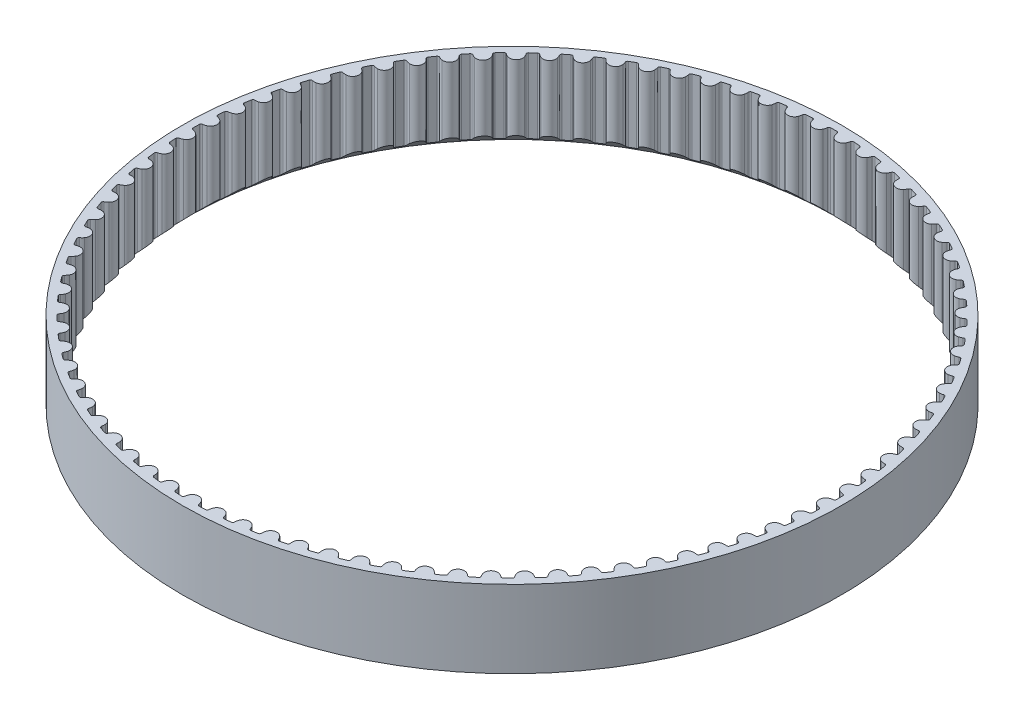
from build123d import *

# Parameters (mm, degrees)
BOSS_EXTRUDE3_OUTLINE_R = 27.685
BOSS_EXTRUDE3_DEPTH     = 6.5


# Read off the part's stored shape, not the designer's step: Boss-Extrude3
with BuildPart() as part:
    # Boss-Extrude3 outline → Boss-Extrude3 (new body)
    with BuildSketch(Plane(origin=(0, 0, 0), x_dir=(1, 0, 0), z_dir=(0, 1, 0))):
        Circle(BOSS_EXTRUDE3_OUTLINE_R)
        with BuildLine():
            ThreePointArc((-0.406733695, 26.901015291), (-0.35782791, 26.994719783), (-0.259268366, 27.032907789))
            ThreePointArc((-0.259268366, 27.032907789), (4.95e-05, 27.034151062), (0.259367362, 27.03290684))
            ThreePointArc((0.259367362, 27.03290684), (0.357926765, 26.994718472), (0.406832207, 26.901013801))
            ThreePointArc((0.406832207, 26.901013801), (0.435415402, 26.756177152), (0.485011037, 26.617127065))
            ThreePointArc((0.485011037, 26.617127065), (0.972057324, 26.287033487), (1.48215289, 26.58025417))
            ThreePointArc((1.48215289, 26.58025417), (1.541882783, 26.715261554), (1.581084995, 26.857591594))
            ThreePointArc((1.581084995, 26.857591594), (1.636777541, 26.947428379), (1.737888216, 26.97823323))
            ThreePointArc((1.737888216, 26.97823323), (1.996589749, 26.960321827), (2.255107569, 26.939929723))
            ThreePointArc((2.255107569, 26.939929723), (2.350577517, 26.89456678), (2.39242908, 26.79750621))
            ThreePointArc((2.39242908, 26.79750621), (2.410237667, 26.650954144), (2.449428664, 26.508621015))
            ThreePointArc((2.449428664, 26.508621015), (2.910766667, 26.143459266), (3.441124339, 26.398207367))
            ThreePointArc((3.441124339, 26.398207367), (3.510661756, 26.528434866), (3.560268348, 26.667481045))
            ThreePointArc((3.560268348, 26.667481045), (3.62244348, 26.752959466), (3.725553056, 26.776212915))
            ThreePointArc((3.725553056, 26.776212915), (3.982225317, 26.739244663), (4.238531162, 26.699816052))
            ThreePointArc((4.238531162, 26.699816052), (4.33039023, 26.647526291), (4.364959335, 26.547639933))
            ThreePointArc((4.364959335, 26.547639933), (4.371896049, 26.400172866), (4.400468361, 26.25533407))
            ThreePointArc((4.400468361, 26.25533407), (4.833578411, 25.857098537), (5.38130156, 26.07198271))
            ThreePointArc((5.38130156, 26.07198271), (5.460266712, 26.196719066), (5.520006749, 26.331721962))
            ThreePointArc((5.520006749, 26.331721962), (5.588324889, 26.412375166), (5.692870216, 26.427950211))
            ThreePointArc((5.692870216, 26.427950211), (5.946111351, 26.372127018), (6.198805367, 26.313877245))
            ThreePointArc((6.198805367, 26.313877245), (6.286551852, 26.254946253), (6.313649695, 26.152779652))
            ThreePointArc((6.313649695, 26.152779652), (6.30967665, 26.005202998), (6.327474226, 25.858649594))
            ThreePointArc((6.327474226, 25.858649594), (6.729990827, 25.429515302), (7.292087977, 25.603361925))
            ThreePointArc((7.292087977, 25.603361925), (7.380049585, 25.721925871), (7.449596787, 25.852148145))
            ThreePointArc((7.449596787, 25.852148145), (7.523684805, 25.927535631), (7.629094894, 25.935347207))
            ThreePointArc((7.629094894, 25.935347207), (7.877521787, 25.860973959), (8.125223846, 25.784221165))
            ThreePointArc((8.125223846, 25.784221165), (8.208378509, 25.718970804), (8.22785709, 25.615081957))
            ThreePointArc((8.22785709, 25.615081957), (8.212995986, 25.468201729), (8.21992162, 25.320734142))
            ThreePointArc((8.21992162, 25.320734142), (8.589646366, 24.863044872), (9.16304754, 24.994904455))
            ThreePointArc((9.16304754, 24.994904455), (9.259525186, 25.106648437), (9.338499711, 25.231378859))
            ThreePointArc((9.338499711, 25.231378859), (9.417952964, 25.301088888), (9.523652101, 25.30109433))
            ThreePointArc((9.523652101, 25.30109433), (9.765907931, 25.208577229), (10.007265171, 25.11374061))
            ThreePointArc((10.007265171, 25.11374061), (10.085373848, 25.042527254), (10.097126783, 24.937483568))
            ThreePointArc((10.097126783, 24.937483568), (10.071458786, 24.792101975), (10.067474653, 24.64452562))
            ThreePointArc((10.067474653, 24.64452562), (10.402388235, 24.160781113), (10.983961713, 24.249933484))
            ThreePointArc((10.983961713, 24.249933484), (11.088428472, 24.354247195), (11.176398988, 24.472804532))
            ThreePointArc((11.176398988, 24.472804532), (11.26078353, 24.536456371), (11.366194422, 24.52865565))
            ThreePointArc((11.366194422, 24.52865565), (11.600956072, 24.418499992), (11.834650283, 24.306097513))
            ThreePointArc((11.834650283, 24.306097513), (11.907286373, 24.229310105), (11.911249471, 24.123685291))
            ThreePointArc((11.911249471, 24.123685291), (11.874914771, 23.980596356), (11.860042631, 23.833717245))
            ThreePointArc((11.860042631, 23.833717245), (12.158315868, 23.326559546), (12.744885297, 23.372517786))
            ThreePointArc((12.744885297, 23.372517786), (12.856770607, 23.4688315), (12.953256649, 23.580568233))
            ThreePointArc((12.953256649, 23.580568233), (13.0421116, 23.637814238), (13.146658531, 23.622249959))
            ThreePointArc((13.146658531, 23.622249959), (13.372643814, 23.495057375), (13.597398639, 23.36570294))
            ThreePointArc((13.597398639, 23.36570294), (13.664165429, 23.283760867), (13.660317045, 23.178131811))
            ThreePointArc((13.660317045, 23.178131811), (13.613514089, 23.038117036), (13.587835169, 22.892737371))
            ThreePointArc((13.587835169, 22.892737371), (13.847838995, 22.3649364), (14.436200737, 22.367449501))
            ThreePointArc((14.436200737, 22.367449501), (14.554893518, 22.455237186), (14.659368114, 22.559543047))
            ThreePointArc((14.659368114, 22.559543047), (14.75220818, 22.610070561), (14.85532015, 22.586827729))
            ThreePointArc((14.85532015, 22.586827729), (15.071294813, 22.443292902), (15.28588272, 22.297693))
            ThreePointArc((15.28588272, 22.297693), (15.346415551, 22.2110438), (15.334776704, 22.105987411))
            ThreePointArc((15.334776704, 22.105987411), (15.277761114, 21.969811509), (15.241415662, 21.826725305))
            ThreePointArc((15.241415662, 21.826725305), (15.461730028, 21.281163726), (16.048670655, 21.240217963))
            ThreePointArc((16.048670655, 21.240217963), (16.173522649, 21.319000153), (16.285415194, 21.41530546))
            ThreePointArc((16.285415194, 21.41530546), (16.381733315, 21.458838518), (16.482847162, 21.428044079))
            ThreePointArc((16.482847162, 21.428044079), (16.687631626, 21.268950947), (16.890880609, 21.107900793))
            ThreePointArc((16.890880609, 21.107900793), (16.944848874, 21.017017715), (16.92548313, 20.913107775))
            ThreePointArc((16.92548313, 20.913107775), (16.858566305, 20.781514491), (16.811752829, 20.641503233))
            ThreePointArc((16.811752829, 20.641503233), (16.991174453, 20.081160716), (17.573488299, 19.99697972))
            ThreePointArc((17.573488299, 19.99697972), (17.703817608, 20.066326134), (17.822516984, 20.154104901))
            ThreePointArc((17.822516984, 20.154104901), (17.921787103, 20.190405741), (18.020350579, 20.152227883))
            ThreePointArc((18.020350579, 20.152227883), (18.212826381, 19.978445356), (18.403626366, 19.802824551))
            ThreePointArc((18.403626366, 19.802824551), (18.450735307, 19.708203966), (18.423748437, 19.606007996))
            ThreePointArc((18.423748437, 19.606007996), (18.347295853, 19.479716047), (18.290270032, 19.343544429))
            ThreePointArc((18.290270032, 19.343544429), (18.427818975, 18.77148137), (19.002325643, 18.644524908))
            ThreePointArc((19.002325643, 18.644524908), (19.137420453, 18.7040568), (19.262278366, 18.782829609))
            ThreePointArc((19.262278366, 18.782829609), (19.363958304, 18.811699969), (19.459433089, 18.766347207))
            ThreePointArc((19.459433089, 18.766347207), (19.638548995, 18.578824425), (19.815857898, 18.389592149))
            ThreePointArc((19.815857898, 18.389592149), (19.855850223, 18.291750842), (19.821389618, 18.191827))
            ThreePointArc((19.821389618, 18.191827), (19.735818834, 18.071526149), (19.668892122, 17.939937893))
            ThreePointArc((19.668892122, 17.939937893), (19.76381714, 17.359278702), (20.327378875, 17.190240167))
            ThreePointArc((20.327378875, 17.190240167), (20.466501345, 17.239632395), (20.596835864, 17.308969016))
            ThreePointArc((20.596835864, 17.308969016), (20.700370281, 17.330251216), (20.792234924, 17.27797125))
            ThreePointArc((20.792234924, 17.27797125), (20.957012664, 17.077732398), (21.119862085, 16.875922172))
            ThreePointArc((21.119862085, 16.875922172), (21.152519371, 16.775394518), (21.110773243, 16.678288553))
            ThreePointArc((21.110773243, 16.678288553), (21.016551616, 16.564635842), (20.940089544, 16.438349637))
            ThreePointArc((20.940089544, 16.438349637), (20.99187219, 15.852265673), (21.541411012, 15.642068295))
            ThreePointArc((21.541411012, 15.642068295), (21.683801303, 15.681051095), (21.818900586, 15.740572836))
            ThreePointArc((21.818900586, 15.740572836), (21.923724013, 15.754150639), (22.011476782, 15.695229005))
            ThreePointArc((22.011476782, 15.695229005), (22.161016397, 15.483367718), (22.308516909, 15.270081759))
            ThreePointArc((22.308516909, 15.270081759), (22.333660792, 15.167416806), (22.284857146, 15.073659078))
            ThreePointArc((22.284857146, 15.073659078), (22.182499281, 14.967275238), (22.096919458, 14.846980816))
            ThreePointArc((22.096919458, 14.846980816), (22.105276912, 14.258673066), (22.637791432, 14.00846487))
            ThreePointArc((22.637791432, 14.00846487), (22.782671859, 14.036825331), (22.921798039, 14.086207106))
            ThreePointArc((22.921798039, 14.086207106), (23.027337967, 14.092006356), (23.110499587, 14.026764862))
            ThreePointArc((23.110499587, 14.026764862), (23.243984343, 13.804438253), (23.37533035, 13.580841456))
            ThreePointArc((23.37533035, 13.580841456), (23.392823503, 13.476599924), (23.337228886, 13.386702504))
            ThreePointArc((23.337228886, 13.386702504), (23.227293828, 13.288168566), (23.133063661, 13.174522935))
            ThreePointArc((23.133063661, 13.174522935), (23.097950278, 12.587204532), (23.610532085, 12.298352067))
            ThreePointArc((23.610532085, 12.298352067), (23.75711136, 12.315935296), (23.89950458, 12.354907397))
            ThreePointArc((23.89950458, 12.354907397), (24.005184586, 12.35289642), (24.083300857, 12.281691394))
            ThreePointArc((24.083300857, 12.281691394), (24.200001708, 12.050113734), (24.314475843, 11.817427306))
            ThreePointArc((24.314475843, 11.817427306), (24.324222725, 11.712178525), (24.262140774, 11.626632403))
            ThreePointArc((24.262140774, 11.626632403), (24.14522895, 11.536486526), (24.042863092, 11.430110377))
            ThreePointArc((24.042863092, 11.430110377), (23.96447065, 10.846989052), (24.4543202, 10.521069931))
            ThreePointArc((24.4543202, 10.521069931), (24.601797758, 10.527779893), (24.746680315, 10.556129469))
            ThreePointArc((24.746680315, 10.556129469), (24.851923211, 10.546319247), (24.924567489, 10.469539586))
            ThreePointArc((24.924567489, 10.469539586), (25.023847055, 10.229975671), (25.1208241, 9.989470465))
            ThreePointArc((25.1208241, 9.989470465), (25.122771476, 9.883789269), (25.054541264, 9.803061667))
            ThreePointArc((25.054541264, 9.803061667), (24.931291204, 9.721796198), (24.821348743, 9.62327052))
            ThreePointArc((24.821348743, 9.62327052), (24.700105392, 9.047531078), (25.164547297, 8.686325358))
            ThreePointArc((25.164547297, 8.686325358), (25.312117668, 8.682125406), (25.458698264, 8.699697622))
            ThreePointArc((25.458698264, 8.699697622), (25.56292925, 8.682141736), (25.629704776, 8.600206783))
            ThreePointArc((25.629704776, 8.600206783), (25.711020826, 8.353965029), (25.789971127, 8.106954602))
            ThreePointArc((25.789971127, 8.106954602), (25.784108362, 8.001418184), (25.710102537, 7.925950009))
            ThreePointArc((25.710102537, 7.925950009), (25.581187391, 7.854008789), (25.464268793, 7.763871697))
            ThreePointArc((25.464268793, 7.763871697), (25.300836725, 7.198658627), (25.737334364, 6.804139089))
            ThreePointArc((25.737334364, 6.804139089), (25.884191568, 6.789052162), (26.03166963, 6.795751043))
            ThreePointArc((26.03166963, 6.795751043), (26.134319433, 6.770545378), (26.194861504, 6.683902633))
            ThreePointArc((26.194861504, 6.683902633), (26.257769918, 6.432327927), (26.318262275, 6.180161363))
            ThreePointArc((26.318262275, 6.180161363), (26.304621388, 6.075346127), (26.225244145, 6.005549559))
            ThreePointArc((26.225244145, 6.005549559), (26.091368004, 5.943325508), (25.968111838, 5.862069299))
            ThreePointArc((25.968111838, 5.862069299), (25.76338366, 5.310469599), (26.169553036, 4.884790972))
            ThreePointArc((26.169553036, 4.884790972), (26.314894991, 4.858899468), (26.462465045, 4.854688428))
            ThreePointArc((26.462465045, 4.854688428), (26.562973027, 4.821970648), (26.616950982, 4.731093325))
            ThreePointArc((26.616950982, 4.731093325), (26.661108176, 4.47555968), (26.702812201, 4.219614226))
            ThreePointArc((26.702812201, 4.219614226), (26.681467695, 4.116092636), (26.597152564, 4.052348881))
            ThreePointArc((26.597152564, 4.052348881), (26.459046612, 4.000181844), (26.330126061, 3.928250311))
            ThreePointArc((26.330126061, 3.928250311), (26.085219929, 3.393276628), (26.458842683, 2.93876382))
            ThreePointArc((26.458842683, 2.93876382), (26.601875582, 2.902209151), (26.748731652, 2.887111189))
            ThreePointArc((26.748731652, 2.887111189), (26.846548873, 2.847059987), (26.893667904, 2.752444426))
            ThreePointArc((26.893667904, 2.752444426), (26.918832707, 2.494347479), (26.941520626, 2.236021019))
            ThreePointArc((26.941520626, 2.236021019), (26.912589077, 2.134358475), (26.823796559, 2.077015678))
            ThreePointArc((26.823796559, 2.077015678), (26.682215082, 2.035190575), (26.548334266, 1.972976582))
            ThreePointArc((26.548334266, 1.972976582), (26.264587771, 1.457550756), (26.603623307, 0.976686159))
            ThreePointArc((26.603623307, 0.976686159), (26.743565953, 0.929667974), (26.888905962, 0.90376555))
            ThreePointArc((26.888905962, 0.90376555), (26.983498179, 0.856599672), (27.023500937, 0.75876263))
            ThreePointArc((27.023500937, 0.75876263), (27.029535908, 0.499512017), (27.033083808, 0.240215442))
            ThreePointArc((27.033083808, 0.240215442), (26.996723231, 0.140967187), (26.903938279, 0.090338536))
            ThreePointArc((26.903938279, 0.090338536), (26.759654548, 0.059083799), (26.621544676, 0.00692714))
            ThreePointArc((26.621544676, 0.00692714), (26.300507543, -0.486135751), (26.603104166, -0.990725822))
            ThreePointArc((26.603104166, -0.990725822), (26.73919224, -1.047950728), (26.882222392, -1.084516143))
            ThreePointArc((26.882222392, -1.084516143), (26.973072974, -1.138539094), (27.00574098, -1.239063265))
            ThreePointArc((27.00574098, -1.239063265), (26.992613157, -1.498051608), (26.977001661, -1.75690211))
            ThreePointArc((26.977001661, -1.75690211), (26.933410644, -1.853194014), (26.837140018, -1.896832003))
            ThreePointArc((26.837140018, -1.896832003), (26.690942059, -1.917345671), (26.54935744, -1.959160137))
            ThreePointArc((26.54935744, -1.959160137), (26.192783063, -2.427167155), (26.457288095, -2.952726803))
            ThreePointArc((26.457288095, -2.952726803), (26.588778333, -3.019845885), (26.728717445, -3.066874586))
            ThreePointArc((26.728717445, -3.066874586), (26.815330199, -3.127459554), (26.84048503, -3.230121826))
            ThreePointArc((26.84048503, -3.230121826), (26.808266113, -3.487433393), (26.773580486, -3.744424071))
            ThreePointArc((26.773580486, -3.744424071), (26.722997107, -3.837233712), (26.623766604, -3.873642705))
            ThreePointArc((26.623766604, -3.873642705), (26.4764529, -3.883303264), (26.33216682, -3.91454716))
            ThreePointArc((26.33216682, -3.91454716), (25.942002685, -4.354942213), (26.166971491, -4.898601014))
            ThreePointArc((26.166971491, -4.898601014), (26.293145738, -4.975247692), (26.429229513, -5.032482822))
            ThreePointArc((26.429229513, -5.032482822), (26.511131389, -5.099298914), (26.528635658, -5.203538581))
            ThreePointArc((26.528635658, -5.203538581), (26.477501616, -5.457768027), (26.423931298, -5.711495287))
            ThreePointArc((26.423931298, -5.711495287), (26.366631827, -5.80031577), (26.264983409, -5.829296913))
            ThreePointArc((26.264983409, -5.829296913), (26.117358537, -5.828051601), (25.971159037, -5.848554284))
            ThreePointArc((25.971159037, -5.848554284), (25.549536084, -6.258932087), (25.733739963, -6.817720765))
            ThreePointArc((25.733739963, -6.817720765), (25.853909099, -6.903476421), (25.985394293, -6.970605383))
            ThreePointArc((25.985394293, -6.970605383), (26.062137973, -7.043287672), (26.071896078, -7.148535413))
            ThreePointArc((26.071896078, -7.148535413), (26.002126186, -7.398294224), (25.92996376, -7.647372296))
            ThreePointArc((25.92996376, -7.647372296), (25.866261148, -7.731718515), (25.762749983, -7.753113522))
            ThreePointArc((25.762749983, -7.753113522), (25.615620218, -7.740969142), (25.468305788, -7.750618633))
            ThreePointArc((25.468305788, -7.750618633), (25.017526777, -8.128737845), (25.159959671, -8.699604489))
            ThreePointArc((25.159959671, -8.699604489), (25.273467374, -8.794000756), (25.399635861, -8.870656914))
            ThreePointArc((25.399635861, -8.870656914), (25.470802196, -8.948808436), (25.472760842, -9.054489424))
            ThreePointArc((25.472760842, -9.054489424), (25.384736161, -9.298413504), (25.294375753, -9.541482009))
            ThreePointArc((25.294375753, -9.541482009), (25.224617919, -9.620893294), (25.11980935, -9.634585315))
            ThreePointArc((25.11980935, -9.634585315), (24.973978264, -9.611608193), (24.826353486, -9.61035179))
            ThreePointArc((24.826353486, -9.61035179), (24.348880414, -9.954147255), (24.448764404, -10.533973991))
            ThreePointArc((24.448764404, -10.533973991), (24.554990734, -10.636495309), (24.675153426, -10.722259994))
            ThreePointArc((24.675153426, -10.722259994), (24.740353731, -10.805453911), (24.73450222, -10.910990953))
            ThreePointArc((24.73450222, -10.910990953), (24.628703509, -11.147748074), (24.520638636, -11.383479456))
            ThreePointArc((24.520638636, -11.383479456), (24.445206575, -11.45752209), (24.33967303, -11.463436343))
            ThreePointArc((24.33967303, -11.463436343), (24.195937102, -11.429751974), (24.048808249, -11.417596538))
            ThreePointArc((24.048808249, -11.417596538), (23.54724891, -11.725190564), (23.604038464, -12.310810579))
            ThreePointArc((23.604038464, -12.310810579), (23.70240325, -12.420897012), (23.81590386, -12.515301807))
            ThreePointArc((23.81590386, -12.515301807), (23.874782033, -12.603083743), (23.861152324, -12.707900433))
            ThreePointArc((23.861152324, -12.707900433), (23.738157419, -12.936197509), (23.612978294, -13.163304286))
            ThreePointArc((23.612978294, -13.163304286), (23.532283989, -13.231573874), (23.426601856, -13.229678057))
            ThreePointArc((23.426601856, -13.229678057), (23.285746121, -13.185470412), (23.139916761, -13.162482334))
            ThreePointArc((23.139916761, -13.162482334), (22.617010498, -13.432194949), (22.630395451, -14.020409789))
            ThreePointArc((22.630395451, -14.020409789), (22.720361458, -14.137460083), (22.826580085, -14.239989382))
            ThreePointArc((22.826580085, -14.239989382), (22.878814554, -14.331879902), (22.857481088, -14.435403768))
            ThreePointArc((22.857481088, -14.435403768), (22.717961745, -14.65399392), (22.576352053, -14.871235712))
            ThreePointArc((22.576352053, -14.871235712), (22.490836229, -14.93335939), (22.385582706, -14.923663857))
            ThreePointArc((22.385582706, -14.923663857), (22.24837647, -14.869174384), (22.104643073, -14.835479215))
            ThreePointArc((22.104643073, -14.835479215), (21.563245817, -15.065837343), (21.533153065, -15.653434383))
            ThreePointArc((21.533153065, -15.653434383), (21.614228931, -15.77680925), (21.712585446, -15.886903073))
            ThreePointArc((21.712585446, -15.886903073), (21.757890924, -15.982400304), (21.728970217, -16.084065934))
            ThreePointArc((21.728970217, -16.084065934), (21.573688442, -16.291755297), (21.416421606, -16.497945606))
            ThreePointArc((21.416421606, -16.497945606), (21.32655132, -16.553584075), (21.222301265, -16.536141781))
            ThreePointArc((21.222301265, -16.536141781), (21.089493902, -16.471668081), (20.948641489, -16.427449854))
            ThreePointArc((20.948641489, -16.427449854), (20.391710165, -16.617195357), (20.318304065, -17.200965346))
            ThreePointArc((20.318304065, -17.200965346), (20.390046981, -17.329990955), (20.480004194, -17.447048008))
            ThreePointArc((20.480004194, -17.447048008), (20.518133239, -17.545630377), (20.481783245, -17.644882508))
            ThreePointArc((20.481783245, -17.644882508), (20.311587134, -17.840536757), (20.139522091, -18.034549443))
            ThreePointArc((20.139522091, -18.034549443), (20.045788183, -18.083398825), (19.943110975, -18.058305032))
            ThreePointArc((19.943110975, -18.058305032), (19.81542783, -17.98419924), (19.678225689, -17.929699457))
            ThreePointArc((19.678225689, -17.929699457), (19.108802064, -18.077796013), (18.992483534, -18.654550601))
            ThreePointArc((18.992483534, -18.654550601), (19.054501665, -18.78852226), (19.135568261, -18.911903218))
            ThreePointArc((19.135568261, -18.911903218), (19.166312625, -19.013032302), (19.122731876, -19.109328853))
            ThreePointArc((19.122731876, -19.109328853), (18.93855098, -19.291879391), (18.75262749, -19.472654824))
            ThreePointArc((18.75262749, -19.472654824), (18.655541903, -19.514448321), (18.554998328, -19.481840083))
            ThreePointArc((18.554998328, -19.481840083), (18.433136764, -19.398506938), (18.300334245, -19.33402326))
            ThreePointArc((18.300334245, -19.33402326), (17.721528312, -19.439662016), (17.562932644, -20.00625117))
            ThreePointArc((17.562932644, -20.00625117), (17.614887268, -20.144437171), (17.68662049, -20.27346817))
            ThreePointArc((17.68662049, -20.27346817), (17.709812258, -20.376591637), (17.659238777, -20.469406671))
            ThreePointArc((17.659238777, -20.469406671), (17.462079028, -20.63785647), (17.26331254, -20.804407316))
            ThreePointArc((17.26331254, -20.804407316), (17.163405522, -20.838916667), (17.065544715, -20.798972079))
            ThreePointArc((17.065544715, -20.798972079), (16.950170297, -20.706866718), (16.822492721, -20.632751333))
            ThreePointArc((16.822492721, -20.632751333), (16.237465717, -20.695355326), (16.037459105, -21.248684532))
            ThreePointArc((16.037459105, -21.248684532), (16.079066466, -21.390330151), (16.141074531, -21.524306469))
            ThreePointArc((16.141074531, -21.524306469), (16.156587038, -21.628861094), (16.099297039, -21.717687687))
            ThreePointArc((16.099297039, -21.717687687), (15.890235256, -21.871116733), (15.679711364, -22.022533351))
            ThreePointArc((15.679711364, -22.022533351), (15.577528572, -22.049570076), (15.482885015, -22.002507303))
            ThreePointArc((15.482885015, -22.002507303), (15.374627878, -21.902132773), (15.252772576, -21.818790472))
            ThreePointArc((15.252772576, -21.818790472), (14.664719716, -21.838017782), (14.424394527, -22.375064948))
            ThreePointArc((14.424394527, -22.375064948), (14.455427378, -22.519396566), (14.50737162, -22.65758647))
            ThreePointArc((14.50737162, -22.65758647), (14.515120142, -22.763001213), (14.451426524, -22.847354225))
            ThreePointArc((14.451426524, -22.847354225), (14.231604529, -22.984924541), (14.010473041, -23.120379945))
            ThreePointArc((14.010473041, -23.120379945), (13.906572562, -23.13979638), (13.815663165, -23.085872461))
            ThreePointArc((13.815663165, -23.085872461), (13.715114573, -22.977776974), (13.599747076, -22.885662944))
            ThreePointArc((13.599747076, -22.885662944), (13.011880101, -22.861408558), (12.732548908, -23.379240519))
            ThreePointArc((12.732548908, -23.379240519), (12.752837759, -23.525469847), (12.794434476, -23.667118591))
            ThreePointArc((12.794434476, -23.667118591), (12.794376693, -23.772817712), (12.724627328, -23.852236436))
            ThreePointArc((12.724627328, -23.852236436), (12.495245714, -23.973196662), (12.264714374, -24.091951041))
            ThreePointArc((12.264714374, -24.091951041), (12.159663676, -24.103641141), (12.072984954, -24.04315059))
            ThreePointArc((12.072984954, -24.04315059), (11.980694068, -23.927924525), (11.872444473, -23.827541861))
            ThreePointArc((11.872444473, -23.827541861), (11.287974109, -23.759938247), (10.971162522, -24.255726784))
            ThreePointArc((10.971162522, -24.255726784), (10.980596562, -24.403055168), (11.011618568, -24.547389118))
            ThreePointArc((11.011618568, -24.547389118), (11.003754795, -24.652795325), (10.92833063, -24.726846003))
            ThreePointArc((10.92833063, -24.726846003), (10.690642199, -24.830535496), (10.451970089, -24.931940255))
            ThreePointArc((10.451970089, -24.931940255), (10.346342923, -24.935840172), (10.264368286, -24.869113367))
            ThreePointArc((10.264368286, -24.869113367), (10.180839166, -24.747386049), (10.080298696, -24.639283007))
            ThreePointArc((10.080298696, -24.639283007), (9.502417116, -24.528699394), (9.14985545, -24.999736682))
            ThreePointArc((9.14985545, -24.999736682), (9.148383154, -25.147359465), (9.168661018, -25.293590317))
            ThreePointArc((9.168661018, -25.293590317), (9.153034205, -25.398127919), (9.07234718, -25.466406112))
            ThreePointArc((9.07234718, -25.466406112), (8.827650103, -25.552258555), (8.582140768, -25.635759858))
            ThreePointArc((8.582140768, -25.635759858), (8.476514033, -25.631848291), (8.399691198, -25.559249672))
            ThreePointArc((8.399691198, -25.559249672), (8.325380051, -25.431685934), (8.233097823, -25.316452934))
            ThreePointArc((8.233097823, -25.316452934), (7.664961217, -25.16349329), (7.278575041, -25.607206687))
            ThreePointArc((7.278575041, -25.607206687), (7.26620445, -25.754317605), (7.27562742, -25.901646697))
            ThreePointArc((7.27562742, -25.901646697), (7.252322915, -26.004744746), (7.166813716, -26.066877542))
            ThreePointArc((7.166813716, -26.066877542), (6.916444445, -26.13442404), (6.66543877, -26.199565829))
            ThreePointArc((6.66543877, -26.199565829), (6.560389362, -26.187864143), (6.489137909, -26.109790217))
            ThreePointArc((6.489137909, -26.109790217), (6.424450598, -25.977086767), (6.340930624, -25.855353174))
            ThreePointArc((6.340930624, -25.855353174), (5.785641957, -25.660852911), (5.367541579, -26.074819008))
            ThreePointArc((5.367541579, -26.074819008), (5.344340257, -26.220614593), (5.342856869, -26.368237265))
            ThreePointArc((5.342856869, -26.368237265), (5.312001953, -26.469332674), (5.222137601, -26.524980726))
            ThreePointArc((5.222137601, -26.524980726), (4.967463565, -26.573852362), (4.712332458, -26.620278857))
            ThreePointArc((4.712332458, -26.620278857), (4.608434121, -26.600850962), (4.543143199, -26.517728143))
            ThreePointArc((4.543143199, -26.517728143), (4.488433023, -26.380609762), (4.414131461, -26.25304044))
            ThreePointArc((4.414131461, -26.25304044), (3.874723528, -26.018061853), (3.427192467, -26.40001971))
            ThreePointArc((3.427192467, -26.40001971), (3.393287131, -26.543703676), (3.380905486, -26.690813665))
            ThreePointArc((3.380905486, -26.690813665), (3.342668678, -26.789354286), (3.248939981, -26.838213663))
            ThreePointArc((3.248939981, -26.838213663), (2.991352122, -26.868143518), (2.733489019, -26.895601154))
            ThreePointArc((2.733489019, -26.895601154), (2.63130921, -26.868553158), (2.572335416, -26.780835433))
            ThreePointArc((2.572335416, -26.780835433), (2.527901183, -26.640051014), (2.463223843, -26.507342704))
            ThreePointArc((2.463223843, -26.507342704), (1.942642701, -26.233169163), (1.468125217, -26.58103266))
            ThreePointArc((1.468125217, -26.58103266), (1.423701047, -26.721820255), (1.40048877, -26.867614096))
            ThreePointArc((1.40048877, -26.867614096), (1.355078906, -26.963061735), (1.257997777, -27.004865584))
            ThreePointArc((1.257997777, -27.004865584), (0.99890295, -27.015690192), (0.739716211, -27.024029003))
            ThreePointArc((0.739716211, -27.024029003), (0.639813, -26.989508633), (0.58747843, -26.897675087))
            ThreePointArc((0.58747843, -26.897675087), (0.553562824, -26.753993545), (0.498862951, -26.616871053))
            ThreePointArc((0.498862951, -26.616871053), (-4.8165e-05, -26.305), (-0.498960423, -26.616869226))
            ThreePointArc((-0.498960423, -26.616869226), (-0.553660798, -26.753991517), (-0.58757693, -26.897672935))
            ThreePointArc((-0.58757693, -26.897672935), (-0.639911837, -26.98950629), (-0.739815175, -27.024026294))
            ThreePointArc((-0.739815175, -27.024026294), (-0.999001883, -27.015686534), (-1.25809667, -27.004860977))
            ThreePointArc((-1.25809667, -27.004860977), (-1.355177646, -26.963056772), (-1.40058716, -26.867608967))
            ThreePointArc((-1.40058716, -26.867608967), (-1.423798903, -26.721815041), (-1.468222558, -26.581027283))
            ThreePointArc((-1.468222558, -26.581027283), (-1.942738769, -26.233162049), (-2.463320914, -26.507333683))
            ThreePointArc((-2.463320914, -26.507333683), (-2.52799874, -26.640041756), (-2.572433489, -26.780826013))
            ThreePointArc((-2.572433489, -26.780826013), (-2.631407603, -26.868543522), (-2.733587512, -26.895591143))
            ThreePointArc((-2.733587512, -26.895591143), (-2.991450514, -26.868132564), (-3.249038263, -26.838201765))
            ThreePointArc((-3.249038263, -26.838201765), (-3.342766782, -26.789342045), (-3.381003229, -26.690801283))
            ThreePointArc((-3.381003229, -26.690801283), (-3.393384335, -26.54369125), (-3.427289145, -26.40000716))
            ThreePointArc((-3.427289145, -26.40000716), (-3.874818807, -26.018047663), (-4.414227601, -26.253024275))
            ThreePointArc((-4.414227601, -26.253024275), (-4.48852963, -26.380593325), (-4.543240308, -26.517711506))
            ThreePointArc((-4.543240308, -26.517711506), (-4.608531534, -26.600834086), (-4.712429942, -26.620261601))
            ThreePointArc((-4.712429942, -26.620261601), (-4.967560879, -26.573834171), (-5.222234736, -26.524961602))
            ThreePointArc((-5.222234736, -26.524961602), (-5.312098885, -26.469313221), (-5.342953431, -26.368217699))
            ThreePointArc((-5.342953431, -26.368217699), (-5.344436278, -26.220595021), (-5.367637067, -26.074799352))
            ThreePointArc((-5.367637067, -26.074799352), (-5.785735928, -25.660831724), (-6.341025307, -25.855329953))
            ThreePointArc((-6.341025307, -25.855329953), (-6.424545727, -25.977063241), (-6.489233524, -26.109766454))
            ThreePointArc((-6.489233524, -26.109766454), (-6.560485264, -26.187840118), (-6.665534714, -26.19954142))
            ThreePointArc((-6.665534714, -26.19954142), (-6.91654015, -26.134398711), (-7.166909174, -26.066851297))
            ThreePointArc((-7.166909174, -26.066851297), (-7.252418146, -26.004718187), (-7.275722273, -25.901620053))
            ThreePointArc((-7.275722273, -25.901620053), (-7.266298763, -25.754290995), (-7.278668816, -25.607180032))
            ThreePointArc((-7.278668816, -25.607180032), (-7.665053367, -25.16346522), (-8.233190532, -25.316422784))
            ThreePointArc((-8.233190532, -25.316422784), (-8.325473183, -25.431655445), (-8.399784797, -25.559218911))
            ThreePointArc((-8.399784797, -25.559218911), (-8.476607898, -25.631817249), (-8.582234647, -25.635728429))
            ThreePointArc((-8.582234647, -25.635728429), (-8.827743677, -25.552226228), (-9.07244044, -25.466372889))
            ThreePointArc((-9.07244044, -25.466372889), (-9.153127214, -25.3980944), (-9.168753644, -25.293556741))
            ThreePointArc((-9.168753644, -25.293556741), (-9.148475245, -25.147325963), (-9.149947, -24.999703174))
            ThreePointArc((-9.149947, -24.999703174), (-9.502506942, -24.528664595), (-10.080388926, -24.639246093))
            ThreePointArc((-10.080388926, -24.639246093), (-10.180929792, -24.747348767), (-10.264459358, -24.869075779))
            ThreePointArc((-10.264459358, -24.869075779), (-10.346434239, -24.935802283), (-10.452061391, -24.93190198))
            ThreePointArc((-10.452061391, -24.93190198), (-10.690733129, -24.830496346), (-10.928421181, -24.726805983))
            ThreePointArc((-10.928421181, -24.726805983), (-11.003845075, -24.652755029), (-11.011708462, -24.547348793))
            ThreePointArc((-11.011708462, -24.547348793), (-10.980685927, -24.403014957), (-10.971251347, -24.255686607))
            ThreePointArc((-10.971251347, -24.255686607), (-11.288061119, -23.75989691), (-11.872531731, -23.827498384))
            ThreePointArc((-11.872531731, -23.827498384), (-11.980781693, -23.927880651), (-12.073073001, -24.043106378))
            ThreePointArc((-12.073073001, -24.043106378), (-12.159751944, -24.103596611), (-12.264802599, -24.091906127))
            ThreePointArc((-12.264802599, -24.091906127), (-12.495333504, -23.973150904), (-12.724714676, -23.852189838))
            ThreePointArc((-12.724714676, -23.852189838), (-12.79446375, -23.772770859), (-12.794521146, -23.667071737))
            ThreePointArc((-12.794521146, -23.667071737), (-12.75292391, -23.525423145), (-12.732634523, -23.379193891))
            ThreePointArc((-12.732634523, -23.379193891), (-13.01196382, -22.861360907), (-13.599830884, -22.885613141))
            ThreePointArc((-13.599830884, -22.885613141), (-13.715198718, -22.977726748), (-13.815747706, -23.085821868))
            ThreePointArc((-13.815747706, -23.085821868), (-13.906657301, -23.139745454), (-14.010557709, -23.120328638))
            ThreePointArc((-14.010557709, -23.120328638), (-14.231688701, -22.984872424), (-14.451510192, -22.847301303))
            ThreePointArc((-14.451510192, -22.847301303), (-14.515203501, -22.762948058), (-14.507454593, -22.657533344))
            ThreePointArc((-14.507454593, -22.657533344), (-14.455509845, -22.51934363), (-14.424476465, -22.375012125))
            ThreePointArc((-14.424476465, -22.375012125), (-14.664799688, -21.837964079), (-15.252852477, -21.818734616))
            ThreePointArc((-15.252852477, -21.818734616), (-15.374708085, -21.90207647), (-15.482965589, -22.002450604))
            ThreePointArc((-15.482965589, -22.002450604), (-15.577609318, -22.049513031), (-15.679792011, -22.022475931))
            ThreePointArc((-15.679792011, -22.022475931), (-15.890315349, -21.871058542), (-16.09937657, -21.717628731))
            ThreePointArc((-16.09937657, -21.717628731), (-16.156666244, -21.628801929), (-16.141153354, -21.52424736))
            ThreePointArc((-16.141153354, -21.52424736), (-16.079144798, -21.390271269), (-16.037536919, -21.248625802))
            ThreePointArc((-16.037536919, -21.248625802), (-16.237541505, -20.695295864), (-16.822568279, -20.632689728))
            ThreePointArc((-16.822568279, -20.632689728), (-16.950246127, -20.706804646), (-17.065620882, -20.798909584))
            ThreePointArc((-17.065620882, -20.798909584), (-17.163481835, -20.838853813), (-17.263388727, -20.804344097))
            ThreePointArc((-17.263388727, -20.804344097), (-17.462154605, -20.637792522), (-17.659313737, -20.469342002))
            ThreePointArc((-17.659313737, -20.469342002), (-17.709886878, -20.376526782), (-17.686694732, -20.2734034))
            ThreePointArc((-17.686694732, -20.2734034), (-17.614961038, -20.144372664), (-17.563005907, -20.006186854))
            ThreePointArc((-17.563005907, -20.006186854), (-17.7215995, -19.439597119), (-18.300405047, -19.333956244))
            ThreePointArc((-18.300405047, -19.333956244), (-18.433207803, -19.398439435), (-18.555069672, -19.481772134))
            ThreePointArc((-18.555069672, -19.481772134), (-18.655613366, -19.514380003), (-18.752698799, -19.47258615))
            ThreePointArc((-18.752698799, -19.47258615), (-18.938621628, -19.291810036), (-19.122801856, -19.109258825))
            ThreePointArc((-19.122801856, -19.109258825), (-19.166382252, -19.012962113), (-19.135637517, -18.911833142))
            ThreePointArc((-19.135637517, -18.911833142), (-19.054570469, -18.788452481), (-18.992551848, -18.65448105))
            ThreePointArc((-18.992551848, -18.65448105), (-19.108868265, -18.077726036), (-19.678291349, -17.929627395))
            ThreePointArc((-19.678291349, -17.929627395), (-19.81549369, -17.984126674), (-19.943177105, -18.058231999))
            ThreePointArc((-19.943177105, -18.058231999), (-20.045854405, -18.083325416), (-20.139588134, -18.034475691))
            ThreePointArc((-20.139588134, -18.034475691), (-20.311652466, -17.840462374), (-20.481847862, -17.644807503))
            ThreePointArc((-20.481847862, -17.644807503), (-20.518197492, -17.545555239), (-20.480068086, -17.44697301))
            ThreePointArc((-20.480068086, -17.44697301), (-20.390110444, -17.329916286), (-20.318367056, -17.200890939))
            ThreePointArc((-20.318367056, -17.200890939), (-20.391771018, -16.617120682), (-20.948701647, -16.427373139))
            ThreePointArc((-20.948701647, -16.427373139), (-21.089554221, -16.471590851), (-21.222361821, -16.536064063))
            ThreePointArc((-21.222361821, -16.536064063), (-21.32661194, -16.553505977), (-21.416482022, -16.497867178))
            ThreePointArc((-21.416482022, -16.497867178), (-21.573748103, -16.291676293), (-21.729029117, -16.083986361))
            ThreePointArc((-21.729029117, -16.083986361), (-21.757949452, -15.982320625), (-21.712643624, -15.88682356))
            ThreePointArc((-21.712643624, -15.88682356), (-21.614286707, -15.776730097), (-21.533210389, -15.653355527))
            ThreePointArc((-21.533210389, -15.653355527), (-21.563300989, -15.065758377), (-22.104697401, -14.835398267))
            ThreePointArc((-22.104697401, -14.835398267), (-22.248430921, -14.869092909), (-22.385637356, -14.92358188))
            ThreePointArc((-22.385637356, -14.92358188), (-22.490890915, -14.933277028), (-22.576406512, -14.871153037))
            ThreePointArc((-22.576406512, -14.871153037), (-22.718015408, -14.653910725), (-22.857533951, -14.435320063))
            ThreePointArc((-22.857533951, -14.435320063), (-22.878867038, -14.331796119), (-22.826632233, -14.23990579))
            ThreePointArc((-22.826632233, -14.23990579), (-22.72041323, -14.13737688), (-22.630446794, -14.020326916))
            ThreePointArc((-22.630446794, -14.020326916), (-22.617059687, -13.432112124), (-23.139964963, -13.162397594))
            ThreePointArc((-23.139964963, -13.162397594), (-23.285794407, -13.185385139), (-23.426650303, -13.229592268))
            ThreePointArc((-23.426650303, -13.229592268), (-23.532332444, -13.231487698), (-23.613026499, -13.163217814))
            ThreePointArc((-23.613026499, -13.163217814), (-23.738204792, -12.936110579), (-23.86119886, -12.707813053))
            ThreePointArc((-23.86119886, -12.707813053), (-23.874828186, -12.602996312), (-23.815949691, -12.515214592))
            ThreePointArc((-23.815949691, -12.515214592), (-23.702448735, -12.420810212), (-23.604083546, -12.31072414))
            ThreePointArc((-23.604083546, -12.31072414), (-23.547291848, -11.725104333), (-24.048850061, -11.417508471))
            ThreePointArc((-24.048850061, -11.417508471), (-24.195978958, -11.429663367), (-24.339715009, -11.46334721))
            ThreePointArc((-24.339715009, -11.46334721), (-24.445248533, -11.457432571), (-24.520680323, -11.38338966))
            ThreePointArc((-24.520680323, -11.38338966), (-24.628744332, -11.147657882), (-24.734542176, -10.910900374))
            ThreePointArc((-24.734542176, -10.910900374), (-24.740393301, -10.80536331), (-24.675192692, -10.722169632))
            ThreePointArc((-24.675192692, -10.722169632), (-24.555029685, -10.636405387), (-24.44880298, -10.533884458))
            ThreePointArc((-24.44880298, -10.533884458), (-24.348916867, -9.954058088), (-24.826388679, -9.610260875))
            ThreePointArc((-24.826388679, -9.610260875), (-24.974013462, -9.611516737), (-25.119844633, -9.634493325))
            ThreePointArc((-25.119844633, -9.634493325), (-25.224653151, -9.62080092), (-25.294410694, -9.54138938))
            ThreePointArc((-25.294410694, -9.54138938), (-25.384770212, -9.298320544), (-25.472794, -9.054396141))
            ThreePointArc((-25.472794, -9.054396141), (-25.470834967, -8.948715161), (-25.399668346, -8.8705639))
            ThreePointArc((-25.399668346, -8.8705639), (-25.273499578, -8.793908204), (-25.159991529, -8.699512353))
            ThreePointArc((-25.159991529, -8.699512353), (-25.017556545, -8.12864623), (-25.468334171, -7.750525367))
            ThreePointArc((-25.468334171, -7.750525367), (-25.615648565, -7.740875336), (-25.762778375, -7.753019178))
            ThreePointArc((-25.762778375, -7.753019178), (-25.866289461, -7.731623791), (-25.929991765, -7.647277339))
            ThreePointArc((-25.929991765, -7.647277339), (-26.002153279, -7.398199003), (-26.071922256, -7.148439937))
            ThreePointArc((-26.071922256, -7.148439937), (-26.062163765, -7.043192232), (-25.98541982, -6.970510223))
            ThreePointArc((-25.98541982, -6.970510223), (-25.85393438, -6.903381743), (-25.73376493, -6.817626527))
            ThreePointArc((-25.73376493, -6.817626527), (-25.549559005, -6.258838524), (-25.971180454, -5.848459176))
            ThreePointArc((-25.971180454, -5.848459176), (-26.117379879, -5.827955958), (-26.265004756, -5.829200729))
            ThreePointArc((-26.265004756, -5.829200729), (-26.366653068, -5.800219214), (-26.423952213, -5.711398521))
            ThreePointArc((-26.423952213, -5.711398521), (-26.477521602, -5.457671065), (-26.528654713, -5.203441432))
            ThreePointArc((-26.528654713, -5.203441432), (-26.511150063, -5.099201829), (-26.429247942, -5.032386037))
            ThreePointArc((-26.429247942, -5.032386037), (-26.293163957, -4.975151406), (-26.16698943, -4.89850519))
            ThreePointArc((-26.16698943, -4.89850519), (-25.942018633, -4.354847213), (-26.332181155, -3.91445073))
            ThreePointArc((-26.332181155, -3.91445073), (-26.47646712, -3.883206306), (-26.623780789, -3.873545207))
            ThreePointArc((-26.623780789, -3.873545207), (-26.723011159, -3.837135851), (-26.773594198, -3.744326025))
            ThreePointArc((-26.773594198, -3.744326025), (-26.808278884, -3.48733522), (-26.840496858, -3.230023535))
            ThreePointArc((-26.840496858, -3.230023535), (-26.815341652, -3.127361355), (-26.728728676, -3.066776704))
            ThreePointArc((-26.728728676, -3.066776704), (-26.588789391, -3.019748516), (-26.457298908, -2.952629915))
            ThreePointArc((-26.457298908, -2.952629915), (-26.192791952, -2.427071236), (-26.549364614, -1.959062912))
            ThreePointArc((-26.549364614, -1.959062912), (-26.69094908, -1.917247927), (-26.837146964, -1.896733725))
            ThreePointArc((-26.837146964, -1.896733725), (-26.93341743, -1.853095382), (-26.977008095, -1.756803319))
            ThreePointArc((-26.977008095, -1.756803319), (-26.992618642, -1.49795276), (-27.005745517, -1.238964369))
            ThreePointArc((-27.005745517, -1.238964369), (-26.973077144, -1.138440317), (-26.882226363, -1.084417699))
            ThreePointArc((-26.882226363, -1.084417699), (-26.739196078, -1.047852807), (-26.603107794, -0.990628401))
            ThreePointArc((-26.603107794, -0.990628401), (-26.300509323, -0.486039438), (-26.62154465, 0.007024629))
            ThreePointArc((-26.62154465, 0.007024629), (-26.759654331, 0.059181795), (-26.903937948, 0.09043706))
            ThreePointArc((-26.903937948, 0.09043706), (-26.996722714, 0.141066051), (-27.033082928, 0.240314438))
            ThreePointArc((-27.033082928, 0.240314438), (-27.029534078, 0.499611), (-27.023498159, 0.758861591))
            ThreePointArc((-27.023498159, 0.758861591), (-26.983495042, 0.856698486), (-26.888902652, 0.903864018))
            ThreePointArc((-26.888902652, 0.903864018), (-26.743562548, 0.92976591), (-26.60361973, 0.976783583))
            ThreePointArc((-26.60361973, 0.976783583), (-26.264582433, 1.457646938), (-26.548327041, 1.973073803))
            ThreePointArc((-26.548327041, 1.973073803), (-26.682207629, 2.035288286), (-26.823788953, 2.077113908))
            ThreePointArc((-26.823788953, 2.077113908), (-26.912581261, 2.13445703), (-26.941512437, 2.236119681))
            ThreePointArc((-26.941512437, 2.236119681), (-26.918823572, 2.494446057), (-26.893657824, 2.752542912))
            ThreePointArc((-26.893657824, 2.752542912), (-26.846538447, 2.847158301), (-26.748721079, 2.887209144))
            ThreePointArc((-26.748721079, 2.887209144), (-26.601864953, 2.902306568), (-26.458831921, 2.938860714))
            ThreePointArc((-26.458831921, 2.938860714), (-26.085207502, 3.393372154), (-26.330111676, 3.928346733))
            ThreePointArc((-26.330111676, 3.928346733), (-26.459031963, 4.000278739), (-26.597137724, 4.052446281))
            ThreePointArc((-26.597137724, 4.052446281), (-26.681452622, 4.116190344), (-26.702796748, 4.219712013))
            ThreePointArc((-26.702796748, 4.219712013), (-26.661091786, 4.475657315), (-26.616933657, 4.731190798))
            ThreePointArc((-26.616933657, 4.731190798), (-26.562955368, 4.822067923), (-26.462447267, 4.854785335))
            ThreePointArc((-26.462447267, 4.854785335), (-26.314877197, 4.858995835), (-26.169535147, 4.884886806))
            ThreePointArc((-26.169535147, 4.884886806), (-25.763364213, 5.310563946), (-25.968090371, 5.862164395))
            ThreePointArc((-25.968090371, 5.862164395), (-26.091346238, 5.943421056), (-26.225222152, 6.005645597))
            ThreePointArc((-26.225222152, 6.005645597), (-26.30459914, 6.075442455), (-26.318239643, 6.180257742))
            ThreePointArc((-26.318239643, 6.180257742), (-26.257746363, 6.432424085), (-26.194837027, 6.68399856))
            ThreePointArc((-26.194837027, 6.68399856), (-26.134294639, 6.770641083), (-26.031644744, 6.795846372))
            ThreePointArc((-26.031644744, 6.795846372), (-25.884166706, 6.789146951), (-25.737309447, 6.80423334))
            ThreePointArc((-25.737309447, 6.80423334), (-25.300810363, 7.19875128), (-25.464240362, 7.763964948))
            ThreePointArc((-25.464240362, 7.763964948), (-25.581158629, 7.854102469), (-25.710073511, 7.92604416))
            ThreePointArc((-25.710073511, 7.92604416), (-25.78407906, 8.001512606), (-25.789941439, 8.107049045))
            ThreePointArc((-25.789941439, 8.107049045), (-25.710990234, 8.354059184), (-25.629673282, 8.60030064))
            ThreePointArc((-25.629673282, 8.60030064), (-25.562897455, 8.682235349), (-25.458666405, 8.699790852))
            ThreePointArc((-25.458666405, 8.699790852), (-25.312085874, 8.6822181), (-25.164515488, 8.686417512))
            ThreePointArc((-25.164515488, 8.686417512), (-24.70007226, 9.047621531), (-24.821313502, 9.623361417))
            ThreePointArc((-24.821313502, 9.623361417), (-24.931255602, 9.721887497), (-25.054505364, 9.803153418))
            ThreePointArc((-25.054505364, 9.803153418), (-25.122735281, 9.88388127), (-25.120787518, 9.989562459))
            ThreePointArc((-25.120787518, 9.989562459), (-25.023809592, 10.23006731), (-24.924529149, 10.469630861))
            ThreePointArc((-24.924529149, 10.469630861), (-24.85188459, 10.546410256), (-24.746641658, 10.556220092))
            ThreePointArc((-24.746641658, 10.556220092), (-24.601759205, 10.527869985), (-24.454281671, 10.521159483))
            ThreePointArc((-24.454281671, 10.521159483), (-23.964430927, 10.84707681), (-24.042821235, 11.430198423))
            ThreePointArc((-24.042821235, 11.430198423), (-24.145186702, 11.536574947), (-24.262098197, 11.626721252))
            ThreePointArc((-24.262098197, 11.626721252), (-24.324179834, 11.712267601), (-24.314432567, 11.817516346))
            ThreePointArc((-24.314432567, 11.817516346), (-24.199957579, 12.050202355), (-24.08325588, 12.281779588))
            ThreePointArc((-24.08325588, 12.281779588), (-24.005139349, 12.352984328), (-23.899459336, 12.354994918))
            ThreePointArc((-23.899459336, 12.354994918), (-23.757066259, 12.316022295), (-23.610487048, 12.29843853))
            ThreePointArc((-23.610487048, 12.29843853), (-23.097904183, 12.587289118), (-23.133015416, 13.174607649))
            ThreePointArc((-23.133015416, 13.174607649), (-23.227245166, 13.288253626), (-23.337179863, 13.386787966))
            ThreePointArc((-23.337179863, 13.386787966), (-23.392774151, 13.476685589), (-23.375280617, 13.580927057))
            ThreePointArc((-23.375280617, 13.580927057), (-23.243933791, 13.804523374), (-23.11044822, 14.026849494))
            ThreePointArc((-23.11044822, 14.026849494), (-23.027286361, 14.092090683), (-22.921746455, 14.086291047))
            ThreePointArc((-22.921746455, 14.086291047), (-22.782620455, 14.036908763), (-22.637740132, 14.00854777))
            ThreePointArc((-22.637740132, 14.00854777), (-22.105224696, 14.258754017), (-22.096865088, 14.847061736))
            ThreePointArc((-22.096865088, 14.847061736), (-22.18244447, 14.967356471), (-22.284801945, 15.073740686))
            ThreePointArc((-22.284801945, 15.073740686), (-22.333605248, 15.167498593), (-22.30846099, 15.270163454))
            ThreePointArc((-22.30846099, 15.270163454), (-22.160959696, 15.483448873), (-22.011419305, 15.695309612))
            ThreePointArc((-22.011419305, 15.695309612), (-21.92366632, 15.754230925), (-21.818842943, 15.740652738))
            ThreePointArc((-21.818842943, 15.740652738), (-21.683743879, 15.681130502), (-21.54135373, 15.64214718))
            ThreePointArc((-21.54135373, 15.64214718), (-20.991814138, 15.852342546), (-20.940029346, 16.438426321))
            ThreePointArc((-20.940029346, 16.438426321), (-21.016490956, 16.564712805), (-21.110712167, 16.678365861))
            ThreePointArc((-21.110712167, 16.678365861), (-21.152457938, 16.775471979), (-21.119800285, 16.875999514))
            ThreePointArc((-21.119800285, 16.875999514), (-20.956950124, 17.077809143), (-20.792171651, 17.278047392))
            ThreePointArc((-20.792171651, 17.278047392), (-20.700306816, 17.330327021), (-20.596772477, 17.309044442))
            ThreePointArc((-20.596772477, 17.309044442), (-20.466438212, 17.239707344), (-20.327315923, 17.190314607))
            ThreePointArc((-20.327315923, 17.190314607), (-19.763753569, 17.359351078), (-19.668826425, 17.940009921))
            ThreePointArc((-19.668826425, 17.940009921), (-19.735752655, 18.071598422), (-19.821322999, 18.191899586))
            ThreePointArc((-19.821322999, 18.191899586), (-19.855783238, 18.291823555), (-19.815790554, 18.389664716))
            ThreePointArc((-19.815790554, 18.389664716), (-19.638480958, 18.578896342), (-19.459364366, 18.766418468))
            ThreePointArc((-19.459364366, 18.766418468), (-19.363889415, 18.811770881), (-19.262209582, 18.782900148))
            ThreePointArc((-19.262209582, 18.782900148), (-19.137351958, 18.704126882), (-19.002257366, 18.644594496))
            ThreePointArc((-19.002257366, 18.644594496), (-18.427750232, 18.771548853), (-18.290199195, 19.343611409))
            ThreePointArc((-18.290199195, 19.343611409), (-18.347224518, 19.479783235), (-18.423676639, 19.606075464))
            ThreePointArc((-18.423676639, 19.606075464), (-18.450663135, 19.708271533), (-18.403553847, 19.802891946))
            ThreePointArc((-18.403553847, 19.802891946), (-18.212753219, 19.978512052), (-18.02027678, 20.152293875))
            ThreePointArc((-18.02027678, 20.152293875), (-17.921713165, 20.190471371), (-17.822443179, 20.154170167))
            ThreePointArc((-17.822443179, 20.154170167), (-17.703744124, 20.066390966), (-17.573415069, 19.997044075))
            ThreePointArc((-17.573415069, 19.997044075), (-16.991100915, 20.081222939), (-16.811677239, 20.641564799))
            ThreePointArc((-16.811677239, 20.641564799), (-16.858490202, 20.781576228), (-16.925406545, 20.913169757))
            ThreePointArc((-16.925406545, 20.913169757), (-16.944771908, 21.017079767), (-16.890803311, 21.107962648))
            ThreePointArc((-16.890803311, 21.107962648), (-16.687553738, 21.269012057), (-16.482768692, 21.42810444))
            ThreePointArc((-16.482768692, 21.42810444), (-16.381654732, 21.458898509), (-16.28533677, 21.415365098))
            ThreePointArc((-16.28533677, 21.415365098), (-16.173444578, 21.319059381), (-16.048592872, 21.240276734))
            ThreePointArc((-16.048592872, 21.240276734), (-15.461652095, 21.281220348), (-15.241335732, 21.826781119))
            ThreePointArc((-15.241335732, 21.826781119), (-15.277680659, 21.969867457), (-15.33469575, 22.106043568))
            ThreePointArc((-15.33469575, 22.106043568), (-15.346334213, 22.211099999), (-15.285801064, 22.297748977))
            ThreePointArc((-15.285801064, 22.297748977), (-15.071212624, 22.443348094), (-14.855237436, 22.58688213))
            ThreePointArc((-14.855237436, 22.58688213), (-14.752125381, 22.610124584), (-14.6592855, 22.55959673))
            ThreePointArc((-14.6592855, 22.55959673), (-14.554811286, 22.455290486), (-14.436118827, 22.367502367))
            ThreePointArc((-14.436118827, 22.367502367), (-13.847757094, 22.364987111), (-13.587751334, 22.89278713))
            ThreePointArc((-13.587751334, 22.89278713), (-13.613429722, 23.038166889), (-13.660232165, 23.178181835))
            ThreePointArc((-13.660232165, 23.178181835), (-13.664080162, 23.283810905), (-13.597313073, 23.365752734))
            ThreePointArc((-13.597313073, 23.365752734), (-13.372557774, 23.495106346), (-13.146572025, 23.622298102))
            ThreePointArc((-13.146572025, 23.622298102), (-13.042025037, 23.637861999), (-12.953170296, 23.580615668))
            ThreePointArc((-12.953170296, 23.580615668), (-12.856684663, 23.468878582), (-12.744799706, 23.372564459))
            ThreePointArc((-12.744799706, 23.372564459), (-12.158230445, 23.32660407), (-11.859955351, 23.833760677))
            ThreePointArc((-11.859955351, 23.833760677), (-11.874826953, 23.980639843), (-11.911161129, 24.123728911))
            ThreePointArc((-11.911161129, 24.123728911), (-11.907197644, 24.22935371), (-11.834561273, 24.306140852))
            ThreePointArc((-11.834561273, 24.306140852), (-11.600866651, 24.418542475), (-11.366104597, 24.528697273))
            ThreePointArc((-11.366104597, 24.528697273), (-11.260693676, 24.536497608), (-11.176309367, 24.47284546))
            ThreePointArc((-11.176309367, 24.47284546), (-11.088339286, 24.354287801), (-10.983872909, 24.249973708))
            ThreePointArc((-10.983872909, 24.249973708), (-10.402299758, 24.160819207), (-10.067384404, 24.644562487))
            ThreePointArc((-10.067384404, 24.644562487), (-10.071367996, 24.792138856), (-10.097035461, 24.937520544))
            ThreePointArc((-10.097035461, 24.937520544), (-10.085282141, 25.042564187), (-10.007173203, 25.113777257))
            ThreePointArc((-10.007173203, 25.113777257), (-9.765815616, 25.208612992), (-9.523559447, 25.301129206))
            ThreePointArc((-9.523559447, 25.301129206), (-9.41786031, 25.301123377), (-9.338407312, 25.231413057))
            ThreePointArc((-9.338407312, 25.231413057), (-9.259433245, 25.106682345), (-9.162956007, 24.99493801))
            ThreePointArc((-9.162956007, 24.99493801), (-8.589555316, 24.863076327), (-8.219828894, 25.320764243))
            ThreePointArc((-8.219828894, 25.320764243), (-8.212902721, 25.468231805), (-8.227763287, 25.615112088))
            ThreePointArc((-8.227763287, 25.615112088), (-8.208284325, 25.719000863), (-8.125129423, 25.78425092))
            ThreePointArc((-8.125129423, 25.78425092), (-7.877427083, 25.861002807), (-7.628999917, 25.935375145))
            ThreePointArc((-7.628999917, 25.935375145), (-7.523589857, 25.927563183), (-7.449502115, 25.852175425))
            ThreePointArc((-7.449502115, 25.852175425), (-7.37995539, 25.721952897), (-7.291994217, 25.603388628))
            ThreePointArc((-7.291994217, 25.603388628), (-6.729897703, 25.429539947), (-6.32737953, 25.858672766))
            ThreePointArc((-6.32737953, 25.858672766), (-6.309581418, 26.005226104), (-6.313553922, 26.152802772))
            ThreePointArc((-6.313553922, 26.152802772), (-6.286455705, 26.254969274), (-6.198709004, 26.313899945))
            ThreePointArc((-6.198709004, 26.313899945), (-5.946014775, 26.372148792), (-5.692773436, 26.427971058))
            ThreePointArc((-5.692773436, 26.427971058), (-5.588228165, 26.41239563), (-5.519910321, 26.331742176))
            ThreePointArc((-5.519910321, 26.331742176), (-5.460170779, 26.196739062), (-5.381206083, 26.072002417))
            ThreePointArc((-5.381206083, 26.072002417), (-4.833483722, 25.857116237), (-4.400372213, 26.255350184))
            ThreePointArc((-4.400372213, 26.255350184), (-4.37179937, 26.400188875), (-4.364862116, 26.547655917))
            ThreePointArc((-4.364862116, 26.547655917), (-4.330292645, 26.647542149), (-4.238433386, 26.699831574))
            ThreePointArc((-4.238433386, 26.699831574), (-3.982127397, 26.739259246), (-3.725455, 26.776226558))
            ThreePointArc((-3.725455, 26.776226558), (-3.622345509, 26.752972731), (-3.56017069, 26.667494083))
            ThreePointArc((-3.56017069, 26.667494083), (-3.510564608, 26.528447722), (-3.441027667, 26.398219969))
            ThreePointArc((-3.441027667, 26.398219969), (-2.910670928, 26.143469926), (-2.449331588, 26.508629985))
            ThreePointArc((-2.449331588, 26.508629985), (-2.41014007, 26.65096297), (-2.392330946, 26.797514971))
            ThreePointArc((-2.392330946, 26.797514971), (-2.350479028, 26.894575388), (-2.255008914, 26.939937981))
            ThreePointArc((-2.255008914, 26.939937981), (-1.996491019, 26.960329138), (-1.737789421, 26.978239594))
            ThreePointArc((-1.737789421, 26.978239594), (-1.636678858, 26.947434373), (-1.580986642, 26.857597384))
            ThreePointArc((-1.580986642, 26.857597384), (-1.54178495, 26.7152672), (-1.482055552, 26.580259597))
            ThreePointArc((-1.482055552, 26.580259597), (-0.971961059, 26.287037047), (-0.484913564, 26.617128841))
            ThreePointArc((-0.484913564, 26.617128841), (-0.43531742, 26.756178747), (-0.406733695, 26.901015291))
        make_face(mode=Mode.SUBTRACT)
    extrude(amount=BOSS_EXTRUDE3_DEPTH)

    # Sketch2 → Cut-Revolve1 (revolve, cut)
    with BuildSketch(Plane.XY, mode=Mode.PRIVATE) as cut_revolve1_sk:
        Polygon((-27.285, 0), (-22.548731255, 4.736268745), (-16.057642199, 0), align=None)
    revolve(cut_revolve1_sk.sketch.rotate(Axis((0, 0, 0), (0, 1, 0)), 270), axis=Axis((0, 0, 0), (0, 1, 0)), mode=Mode.SUBTRACT)


solid = part.part
